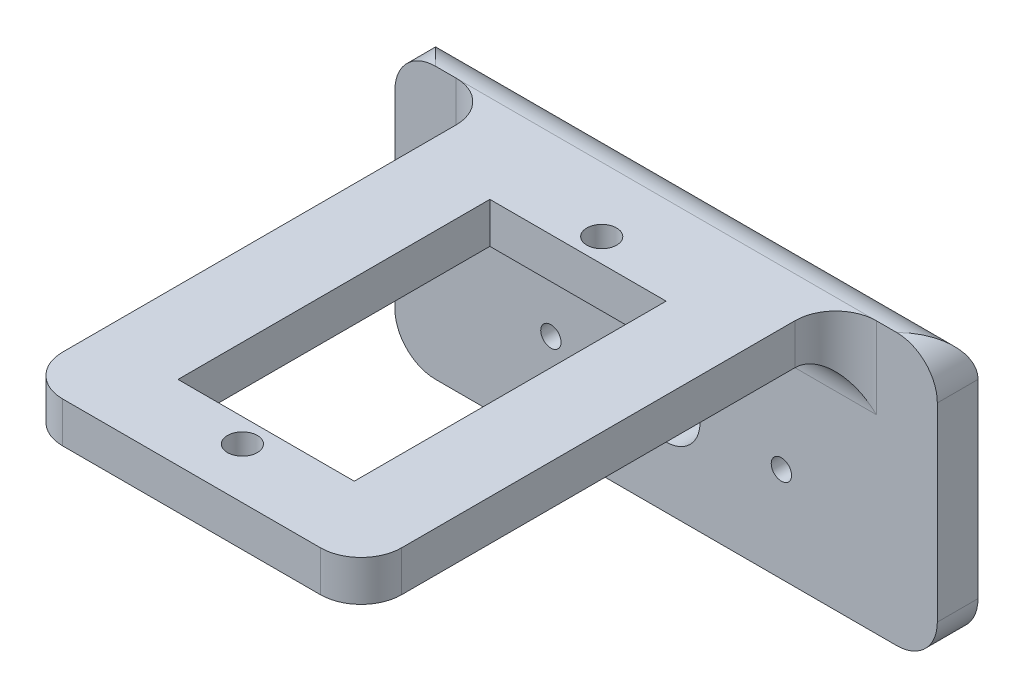
from build123d import *

# Parameters (mm, degrees)
ESBO_O1_W                         = 40
ESBO_O1_H                         = 20
RESSALTO_EXTRUS_O1_DEPTH          = 1
ESBO_O3_W                         = 40
ESBO_O3_H                         = 20
RESSALTO_EXTRUS_O2_DEPTH          = 2
CORTE_EXTRUS_O1_REACH             = 25.409
ESBO_O2_R                         = 2.5
ESBO_O2_R_2                       = 0.75
CORTE_EXTRUS_O1_DIRECTION_2_REACH = 25.409
ESBO_O4_W                         = 25
ESBO_O4_H                         = 35
ESBO_O4_R                         = 1.1
ESBO_O4_W_2                       = 13
ESBO_O4_H_2                       = 23
ESBO_O4_H_3                       = 3
RESSALTO_EXTRUS_O3_DEPTH          = 3
FILLET2_R                         = 3


with BuildPart() as part:
    # Esboço1 → Ressalto-extrusão1 (new body)
    with BuildSketch(Plane.XY):
        with Locations((0, -2)):
            Rectangle(ESBO_O1_W, ESBO_O1_H)
    extrude(amount=-RESSALTO_EXTRUS_O1_DEPTH)

    # Esboço3 → Ressalto-extrusão2 (add)
    with BuildSketch(Plane.XY):
        with Locations((0, -2)):
            Rectangle(ESBO_O3_W, ESBO_O3_H)
    extrude(amount=RESSALTO_EXTRUS_O2_DEPTH)

    # Corte-extrusão1: up to this face of the body (flat: up to its plane)
    corte_extrus_o1_end = Plane(part.part.faces().sort_by_distance((0, -2, 2))[0])
    # Esboço2 → Corte-extrusão1 (cut, up to the picked face)
    with BuildSketch(Plane.XY, mode=Mode.PRIVATE) as corte_extrus_o1_sk1:
        with Locations(Location((0, -5, 0), (0, 0, 180))):
            Circle(ESBO_O2_R)
    corte_extrus_o1_tool1 = split(extrude(corte_extrus_o1_sk1.sketch, amount=CORTE_EXTRUS_O1_REACH, mode=Mode.PRIVATE), bisect_by=corte_extrus_o1_end, keep=Keep.BOTH, mode=Mode.PRIVATE)
    # Esboço2 → Corte-extrusão1 (cut, up to the picked face)
    with BuildSketch(Plane.XY, mode=Mode.PRIVATE) as corte_extrus_o1_sk2:
        with Locations(Location((-8.5, -5, 0), (0, 0, 180))):
            Circle(ESBO_O2_R_2)
    corte_extrus_o1_tool2 = split(extrude(corte_extrus_o1_sk2.sketch, amount=CORTE_EXTRUS_O1_REACH, mode=Mode.PRIVATE), bisect_by=corte_extrus_o1_end, keep=Keep.BOTH, mode=Mode.PRIVATE)
    corte_extrus_o1_1 = corte_extrus_o1_tool1.solids().sort_by(Axis((0, -5, 0), (0, 0, 1)))[0]
    add(corte_extrus_o1_1, mode=Mode.SUBTRACT)
    corte_extrus_o1_2 = corte_extrus_o1_tool2.solids().sort_by(Axis((-8.5, -5, 0), (0, 0, 1)))[0]
    add(corte_extrus_o1_2, mode=Mode.SUBTRACT)
    corte_extrus_o1 = corte_extrus_o1_1 + corte_extrus_o1_2  # Corte-extrusão1 as one shape, for the pattern or mirror that repeats it

    # Corte-extrusão1 direction 2: up to this face of the body (flat: up to its plane)
    corte_extrus_o1_direction_2_end = Plane(part.part.faces().sort_by_distance((0, -2, -1))[0])
    # Esboço2 → Corte-extrusão1 direction 2 (cut, up to the picked face)
    with BuildSketch(Plane.XY, mode=Mode.PRIVATE) as corte_extrus_o1_direction_2_sk1:
        with Locations(Location((0, -5, 0), (0, 0, 180))):
            Circle(ESBO_O2_R)
    corte_extrus_o1_direction_2_tool1 = split(extrude(corte_extrus_o1_direction_2_sk1.sketch, amount=-CORTE_EXTRUS_O1_DIRECTION_2_REACH, mode=Mode.PRIVATE), bisect_by=corte_extrus_o1_direction_2_end, keep=Keep.BOTH, mode=Mode.PRIVATE)
    # Esboço2 → Corte-extrusão1 direction 2 (cut, up to the picked face)
    with BuildSketch(Plane.XY, mode=Mode.PRIVATE) as corte_extrus_o1_direction_2_sk2:
        with Locations(Location((-8.5, -5, 0), (0, 0, 180))):
            Circle(ESBO_O2_R_2)
    corte_extrus_o1_direction_2_tool2 = split(extrude(corte_extrus_o1_direction_2_sk2.sketch, amount=-CORTE_EXTRUS_O1_DIRECTION_2_REACH, mode=Mode.PRIVATE), bisect_by=corte_extrus_o1_direction_2_end, keep=Keep.BOTH, mode=Mode.PRIVATE)
    corte_extrus_o1_direction_2_1 = corte_extrus_o1_direction_2_tool1.solids().sort_by(Axis((0, -5, 0), (0, 0, -1)))[0]
    add(corte_extrus_o1_direction_2_1, mode=Mode.SUBTRACT)
    corte_extrus_o1_direction_2_2 = corte_extrus_o1_direction_2_tool2.solids().sort_by(Axis((-8.5, -5, 0), (0, 0, -1)))[0]
    add(corte_extrus_o1_direction_2_2, mode=Mode.SUBTRACT)
    corte_extrus_o1_direction_2 = corte_extrus_o1_direction_2_1 + corte_extrus_o1_direction_2_2  # Corte-extrusão1 direction 2 as one shape, for the pattern or mirror that repeats it

    # Esboço4 → Ressalto-extrusão3 (add)
    # profile 1 of 2: a face of its own
    with BuildSketch(Plane(origin=(0, 8, 0), x_dir=(1, 0, 0), z_dir=(0, 1, 0))):
        with Locations((0, -19.5)):
            Rectangle(ESBO_O4_W, ESBO_O4_H)
        with Locations(Location((0, -33.25, 0), (0, 0, 180))):
            Circle(ESBO_O4_R, mode=Mode.SUBTRACT)
        with Locations((0, -20)):
            Rectangle(ESBO_O4_W_2, ESBO_O4_H_2, mode=Mode.SUBTRACT)
        with Locations(Location((0, -6.75, 0), (0, 0, 180))):
            Circle(ESBO_O4_R, mode=Mode.SUBTRACT)
    # profile 2 of 2: a face of its own
    with BuildSketch(Plane(origin=(0, 8, 0), x_dir=(1, 0, 0), z_dir=(0, 1, 0))):
        with Locations((0, -0.5)):
            Rectangle(ESBO_O4_W, ESBO_O4_H_3)
    extrude(amount=-RESSALTO_EXTRUS_O3_DEPTH)

    # Mirror1: Corte-extrusão1, Corte-extrusão1 direction 2 across plane
    add(corte_extrus_o1.mirror(Plane(origin=(0, 0, 0), x_dir=(0, 0, 1), z_dir=(1, 0, 0))), mode=Mode.SUBTRACT)
    add(corte_extrus_o1_direction_2.mirror(Plane(origin=(0, 0, 0), x_dir=(0, 0, 1), z_dir=(1, 0, 0))), mode=Mode.SUBTRACT)

    # Fillet2
    fillet2_edges = [part.edges().sort_by_distance(p)[0] for p in [
        (0, 8, -1),
        (0, 5, 2),
        (12.5, 6.5, 2),
        (-12.5, 6.5, 2),
        (-12.5, 6.5, 37),
        (12.5, 6.5, 37),
        (-20, -12, 0.5),
        (-20, 8, 0.5),
        (20, 8, 0.5),
        (20, -12, 0.5),
    ]]
    fillet(fillet2_edges, radius=FILLET2_R - 0.0001)  # a hair under: the kernel refuses the full size


solid = part.part
